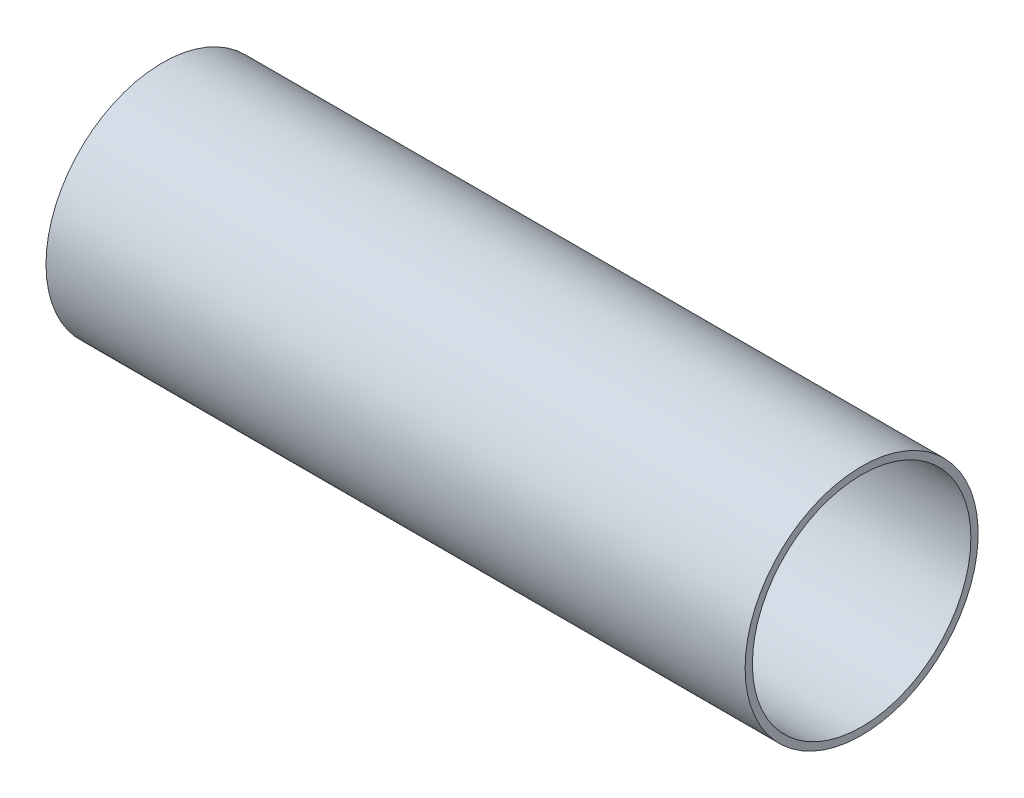
from build123d import *

# Parameters (mm, degrees)
SKETCH1_R           = 203.2
BOSS_EXTRUDE2_DEPTH = 1219.2
SKETCH2_R           = 190.5
CUT_EXTRUDE1_DEPTH  = 1219.2


with BuildPart() as part:
    # Sketch1 → Boss-Extrude2 (new body)
    with BuildSketch(Plane(origin=(0, 0, 0), x_dir=(0, 0, -1), z_dir=(1, 0, 0))):
        Circle(SKETCH1_R)
    extrude(amount=BOSS_EXTRUDE2_DEPTH)

    # Sketch2 → Cut-Extrude1 (cut)
    with BuildSketch(Plane(origin=(0, 0, 0), x_dir=(0, 0, -1), z_dir=(1, 0, 0))):
        Circle(SKETCH2_R)
    extrude(amount=CUT_EXTRUDE1_DEPTH, mode=Mode.SUBTRACT)


solid = part.part
